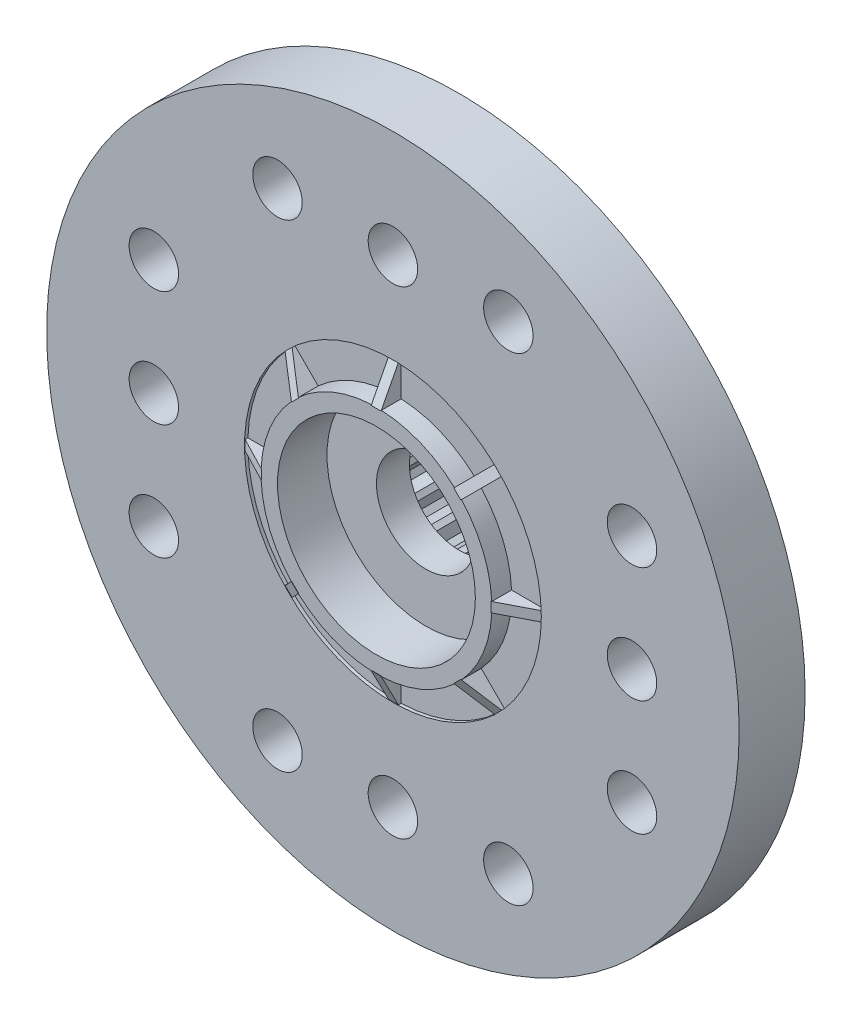
from build123d import *

# Parameters (mm, degrees)
SKETCH_1_R                 = 4
SKETCH_1_R_2               = 2.9
EXTRUDE_1_DEPTH            = 3.5
CUT_EXTRUDE_1_DEPTH        = 7.652067348
PATTERN_CIRCULAR_1_DEPTH   = 3.5
SKETCH_3_R                 = 10.5
EXTRUDE_2_DEPTH            = 2
SKETCH_4_R                 = 1.5
CUT_EXTRUDE_2_DEPTH        = 2
SKETCH_4_3_R               = 3
SKETCH_4_3_R_2             = 1.5
CUT_EXTRUDE_3_DEPTH        = 1
SKETCH_4_4_R               = 4.5
SKETCH_4_4_R_2             = 3.5
CUT_EXTRUDE_4_DEPTH        = 0.1
EXTRUDE_START              = 0.5
SKETCH_5_R                 = 3.5
SKETCH_5_R_2               = 3
EXTRUDE_4_DEPTH            = 0.5
EXTRUDE_8_DEPTH            = 0.15
PATTERN_START              = -0.15
PATTERN_CIRCULAR_2_DEPTH   = 0.3
PATTERN_CIRCULAR_2_2_DEPTH = 0.3
PATTERN_CIRCULAR_2_3_DEPTH = 0.3
PATTERN_CIRCULAR_2_4_DEPTH = 0.3
SKETCH_9_R                 = 0.75
CUT_EXTRUDE_6_DEPTH        = 16.835087622
FILLET_1_R                 = 0.2


# Read off the part's stored shape, not the designer's step: 阵列(圆周)1, 阵列(圆周)2
with BuildPart() as part:
    # 草图1 → 凸台-拉伸1 (new body)
    with BuildSketch(Plane.XY):
        Circle(SKETCH_1_R)
        Circle(SKETCH_1_R_2, mode=Mode.SUBTRACT)
    extrude(amount=EXTRUDE_1_DEPTH)

    # 草图2 → 切除-拉伸1 (cut, through all)
    with BuildSketch(Plane.XY):
        Polygon((-2.865550363, 0.3), (-2.865550363, -0.3), (-3.285550363, -0.1), (-3.285550363, 0.1), align=None)
    extrude(amount=CUT_EXTRUDE_1_DEPTH, mode=Mode.SUBTRACT)

    # 阵列(圆周)1 outline → 阵列(圆周)1 (cut)
    with BuildSketch(Plane.XY):
        with BuildLine():
            Line((-3.147716045, -0.94695559), (-2.711892756, -1.027442301))
            ThreePointArc((-2.711892756, -1.027442301), (-2.801184896, -0.750575231), (-2.862289169, -0.466155244))
            Line((-2.862289169, -0.466155244), (-3.199479854, -0.753770425))
            Line((-3.199479854, -0.753770425), (-3.147716045, -0.94695559))
        make_face()
        with BuildLine():
            Line((-2.79537008, -1.729377722), (-2.353565615, -1.694322547))
            ThreePointArc((-2.353565615, -1.694322547), (-2.511473671, -1.45), (-2.644109176, -1.191086339))
            Line((-2.644109176, -1.191086339), (-2.89537008, -1.556172641))
            Line((-2.89537008, -1.556172641), (-2.79537008, -1.729377722))
        make_face()
        with BuildLine():
            Line((-2.252524264, -2.39394562), (-1.834846868, -2.245737512))
            ThreePointArc((-1.834846868, -2.245737512), (-2.050609665, -2.050609665), (-2.245737512, -1.834846868))
            Line((-2.245737512, -1.834846868), (-2.39394562, -2.252524264))
            Line((-2.39394562, -2.252524264), (-2.252524264, -2.39394562))
        make_face()
        with BuildLine():
            Line((-1.556172641, -2.89537008), (-1.191086339, -2.644109176))
            ThreePointArc((-1.191086339, -2.644109176), (-1.45, -2.511473671), (-1.694322547, -2.353565615))
            Line((-1.694322547, -2.353565615), (-1.729377722, -2.79537008))
            Line((-1.729377722, -2.79537008), (-1.556172641, -2.89537008))
        make_face()
        with BuildLine():
            Line((-0.753770425, -3.199479854), (-0.466155244, -2.862289169))
            ThreePointArc((-0.466155244, -2.862289169), (-0.750575231, -2.801184896), (-1.027442301, -2.711892756))
            Line((-1.027442301, -2.711892756), (-0.94695559, -3.147716045))
            Line((-0.94695559, -3.147716045), (-0.753770425, -3.199479854))
        make_face()
        with BuildLine():
            Line((0.1, -3.285550363), (0.290543561, -2.885408886))
            ThreePointArc((0.290543561, -2.885408886), (0, -2.9), (-0.290543561, -2.885408886))
            Line((-0.290543561, -2.885408886), (-0.1, -3.285550363))
            Line((-0.1, -3.285550363), (0.1, -3.285550363))
        make_face()
        with BuildLine():
            Line((0.94695559, -3.147716045), (1.027442301, -2.711892756))
            ThreePointArc((1.027442301, -2.711892756), (0.750575231, -2.801184896), (0.466155244, -2.862289169))
            Line((0.466155244, -2.862289169), (0.753770425, -3.199479854))
            Line((0.753770425, -3.199479854), (0.94695559, -3.147716045))
        make_face()
        with BuildLine():
            Line((1.729377722, -2.79537008), (1.694322547, -2.353565615))
            ThreePointArc((1.694322547, -2.353565615), (1.45, -2.511473671), (1.191086339, -2.644109176))
            Line((1.191086339, -2.644109176), (1.556172641, -2.89537008))
            Line((1.556172641, -2.89537008), (1.729377722, -2.79537008))
        make_face()
        with BuildLine():
            Line((2.39394562, -2.252524264), (2.245737512, -1.834846868))
            ThreePointArc((2.245737512, -1.834846868), (2.050609665, -2.050609665), (1.834846868, -2.245737512))
            Line((1.834846868, -2.245737512), (2.252524264, -2.39394562))
            Line((2.252524264, -2.39394562), (2.39394562, -2.252524264))
        make_face()
        with BuildLine():
            Line((2.89537008, -1.556172641), (2.644109176, -1.191086339))
            ThreePointArc((2.644109176, -1.191086339), (2.511473671, -1.45), (2.353565615, -1.694322547))
            Line((2.353565615, -1.694322547), (2.79537008, -1.729377722))
            Line((2.79537008, -1.729377722), (2.89537008, -1.556172641))
        make_face()
        with BuildLine():
            Line((3.199479854, -0.753770425), (2.862289169, -0.466155244))
            ThreePointArc((2.862289169, -0.466155244), (2.801184896, -0.750575231), (2.711892756, -1.027442301))
            Line((2.711892756, -1.027442301), (3.147716045, -0.94695559))
            Line((3.147716045, -0.94695559), (3.199479854, -0.753770425))
        make_face()
        with BuildLine():
            Line((3.285550363, 0.1), (2.885408886, 0.290543561))
            ThreePointArc((2.885408886, 0.290543561), (2.9, 0), (2.885408886, -0.290543561))
            Line((2.885408886, -0.290543561), (3.285550363, -0.1))
            Line((3.285550363, -0.1), (3.285550363, 0.1))
        make_face()
        with BuildLine():
            Line((3.147716045, 0.94695559), (2.711892756, 1.027442301))
            ThreePointArc((2.711892756, 1.027442301), (2.801184896, 0.750575231), (2.862289169, 0.466155244))
            Line((2.862289169, 0.466155244), (3.199479854, 0.753770425))
            Line((3.199479854, 0.753770425), (3.147716045, 0.94695559))
        make_face()
        with BuildLine():
            Line((2.79537008, 1.729377722), (2.353565615, 1.694322547))
            ThreePointArc((2.353565615, 1.694322547), (2.511473671, 1.45), (2.644109176, 1.191086339))
            Line((2.644109176, 1.191086339), (2.89537008, 1.556172641))
            Line((2.89537008, 1.556172641), (2.79537008, 1.729377722))
        make_face()
        with BuildLine():
            Line((2.252524264, 2.39394562), (1.834846868, 2.245737512))
            ThreePointArc((1.834846868, 2.245737512), (2.050609665, 2.050609665), (2.245737512, 1.834846868))
            Line((2.245737512, 1.834846868), (2.39394562, 2.252524264))
            Line((2.39394562, 2.252524264), (2.252524264, 2.39394562))
        make_face()
        with BuildLine():
            Line((1.556172641, 2.89537008), (1.191086339, 2.644109176))
            ThreePointArc((1.191086339, 2.644109176), (1.45, 2.511473671), (1.694322547, 2.353565615))
            Line((1.694322547, 2.353565615), (1.729377722, 2.79537008))
            Line((1.729377722, 2.79537008), (1.556172641, 2.89537008))
        make_face()
        with BuildLine():
            Line((0.753770425, 3.199479854), (0.466155244, 2.862289169))
            ThreePointArc((0.466155244, 2.862289169), (0.750575231, 2.801184896), (1.027442301, 2.711892756))
            Line((1.027442301, 2.711892756), (0.94695559, 3.147716045))
            Line((0.94695559, 3.147716045), (0.753770425, 3.199479854))
        make_face()
        with BuildLine():
            Line((-0.1, 3.285550363), (-0.290543561, 2.885408886))
            ThreePointArc((-0.290543561, 2.885408886), (0, 2.9), (0.290543561, 2.885408886))
            Line((0.290543561, 2.885408886), (0.1, 3.285550363))
            Line((0.1, 3.285550363), (-0.1, 3.285550363))
        make_face()
        with BuildLine():
            Line((-0.94695559, 3.147716045), (-1.027442301, 2.711892756))
            ThreePointArc((-1.027442301, 2.711892756), (-0.750575231, 2.801184896), (-0.466155244, 2.862289169))
            Line((-0.466155244, 2.862289169), (-0.753770425, 3.199479854))
            Line((-0.753770425, 3.199479854), (-0.94695559, 3.147716045))
        make_face()
        with BuildLine():
            Line((-1.729377722, 2.79537008), (-1.694322547, 2.353565615))
            ThreePointArc((-1.694322547, 2.353565615), (-1.45, 2.511473671), (-1.191086339, 2.644109176))
            Line((-1.191086339, 2.644109176), (-1.556172641, 2.89537008))
            Line((-1.556172641, 2.89537008), (-1.729377722, 2.79537008))
        make_face()
        with BuildLine():
            Line((-2.39394562, 2.252524264), (-2.245737512, 1.834846868))
            ThreePointArc((-2.245737512, 1.834846868), (-2.050609665, 2.050609665), (-1.834846868, 2.245737512))
            Line((-1.834846868, 2.245737512), (-2.252524264, 2.39394562))
            Line((-2.252524264, 2.39394562), (-2.39394562, 2.252524264))
        make_face()
        with BuildLine():
            Line((-2.89537008, 1.556172641), (-2.644109176, 1.191086339))
            ThreePointArc((-2.644109176, 1.191086339), (-2.511473671, 1.45), (-2.353565615, 1.694322547))
            Line((-2.353565615, 1.694322547), (-2.79537008, 1.729377722))
            Line((-2.79537008, 1.729377722), (-2.89537008, 1.556172641))
        make_face()
        with BuildLine():
            Line((-2.711892756, 1.027442301), (-3.147716045, 0.94695559))
            Line((-3.147716045, 0.94695559), (-3.199479854, 0.753770425))
            Line((-3.199479854, 0.753770425), (-2.862289169, 0.466155244))
            ThreePointArc((-2.862289169, 0.466155244), (-2.801184896, 0.750575231), (-2.711892756, 1.027442301))
        make_face()
    extrude(amount=PATTERN_CIRCULAR_1_DEPTH, mode=Mode.SUBTRACT)

    # 草图3 → 凸台-拉伸2 (add)
    with BuildSketch(Plane.XY.offset(3.5)):
        Circle(SKETCH_3_R)
    extrude(amount=EXTRUDE_2_DEPTH)

    # 草图4 → 切除-拉伸2 (cut)
    with BuildSketch(Plane.XY.offset(5.5)):
        Circle(SKETCH_4_R)
    extrude(amount=-CUT_EXTRUDE_2_DEPTH, mode=Mode.SUBTRACT)

    # 草图4<3> → 切除-拉伸3 (cut)
    with BuildSketch(Plane.XY.offset(5.5)):
        Circle(SKETCH_4_3_R)
        Circle(SKETCH_4_3_R_2, mode=Mode.SUBTRACT)
    extrude(amount=-CUT_EXTRUDE_3_DEPTH, mode=Mode.SUBTRACT)

    # 草图4<4> → 切除-拉伸4 (cut)
    with BuildSketch(Plane.XY.offset(5.5)):
        Circle(SKETCH_4_4_R)
        Circle(SKETCH_4_4_R_2, mode=Mode.SUBTRACT)
    extrude(amount=-CUT_EXTRUDE_4_DEPTH, mode=Mode.SUBTRACT)

    # 草图5 → 凸台-拉伸4 (add)
    with BuildSketch(Plane.XY.offset(5.5).offset(EXTRUDE_START)):
        Circle(SKETCH_5_R)
        Circle(SKETCH_5_R_2, mode=Mode.SUBTRACT)
    extrude(amount=-EXTRUDE_4_DEPTH)

    # 草图8 → 凸台-拉伸8 (add, symmetric)
    with BuildSketch(Plane(origin=(0, 0, 0), x_dir=(1, 0, 0), z_dir=(0, 1, 0))):
        Polygon((4.505833425, -5.4), (3.48099365, -5.4), (3.48099365, -6.0098454), (4.505833425, -5.478972428), align=None)
    extrude(amount=EXTRUDE_8_DEPTH, both=True)

    # 阵列(圆周)2 outline → 阵列(圆周)2 (add)
    with BuildSketch(Plane(origin=(0, 0, 0), x_dir=(1, 0, 0), z_dir=(0, 1, 0)).offset(PATTERN_START)):
        Polygon((-4.5, -5.481994177), (-3.48099365, -6.0098454), (-3.48099365, -5.4), (-4.658288138, -5.4), align=None)
    extrude(amount=PATTERN_CIRCULAR_2_DEPTH)

    # Pattern Circular 2 2 outline → Pattern Circular 2 2 (add)
    with BuildSketch(Plane(origin=(0, 0, 0), x_dir=(0.707106781186546, -0.707106781186549, 0), z_dir=(0.707106781186549, 0.707106781186546, 0)).offset(PATTERN_START)):
        Polygon((3.48099365, -6.0098454), (4.5, -5.481994177), (4.658288138, -5.4), (3.48099365, -5.4), align=None)
        Polygon((-3.48099365, -6.0098454), (-3.48099365, -5.4), (-4.658288138, -5.4), (-4.5, -5.481994177), align=None)
    extrude(amount=PATTERN_CIRCULAR_2_2_DEPTH)

    # Pattern Circular 2 3 outline → Pattern Circular 2 3 (add)
    with BuildSketch(Plane.YZ.offset(PATTERN_START)):
        Polygon((-3.48099365, 6.0098454), (-4.5, 5.481994177), (-4.658288138, 5.4), (-3.48099365, 5.4), align=None)
        Polygon((3.48099365, 6.0098454), (3.48099365, 5.4), (4.658288138, 5.4), (4.5, 5.481994177), align=None)
    extrude(amount=PATTERN_CIRCULAR_2_3_DEPTH)

    # Pattern Circular 2 4 outline → Pattern Circular 2 4 (add)
    with BuildSketch(Plane(origin=(0, 0, 0), x_dir=(0.7071067811865509, 0.707106781186544, 0), z_dir=(0.707106781186544, -0.707106781186551, 0)).offset(PATTERN_START)):
        Polygon((-3.48099365, 6.0098454), (-4.5, 5.481994177), (-4.658288138, 5.4), (-3.48099365, 5.4), align=None)
        Polygon((3.48099365, 6.0098454), (3.48099365, 5.4), (4.658288138, 5.4), (4.5, 5.481994177), align=None)
    extrude(amount=PATTERN_CIRCULAR_2_4_DEPTH)

    # 草图9 → 切除-拉伸6 (cut, through all)
    with BuildSketch(Plane.XY.offset(5.5)):
        with Locations((7.25, 0)):
            Circle(SKETCH_9_R)
        with Locations((7.25, 3.5)):
            Circle(SKETCH_9_R)
        with Locations((7.25, -3.5)):
            Circle(SKETCH_9_R)
        with Locations((0, -7.25)):
            Circle(SKETCH_9_R)
        with Locations((3.5, -7.25)):
            Circle(SKETCH_9_R)
        with Locations((-3.5, -7.25)):
            Circle(SKETCH_9_R)
        with Locations((-7.25, 0)):
            Circle(SKETCH_9_R)
        with Locations((-7.25, -3.5)):
            Circle(SKETCH_9_R)
        with Locations((-7.25, 3.5)):
            Circle(SKETCH_9_R)
        with Locations((0, 7.25)):
            Circle(SKETCH_9_R)
        with Locations((-3.5, 7.25)):
            Circle(SKETCH_9_R)
        with Locations((3.5, 7.25)):
            Circle(SKETCH_9_R)
    extrude(amount=-CUT_EXTRUDE_6_DEPTH, mode=Mode.SUBTRACT)

    # 圆角1
    fillet_1_edges = [part.edges().sort_by_distance(p)[0] for p in [
        (-4, 0, 3.5),
    ]]
    fillet(fillet_1_edges, radius=FILLET_1_R)


solid = part.part
